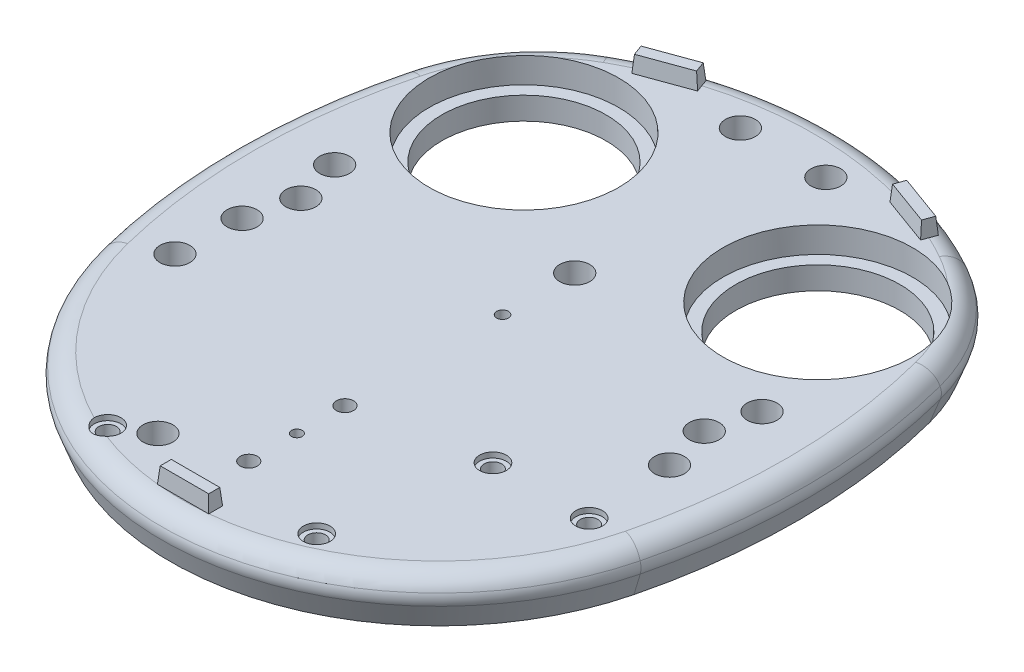
from build123d import *
from OCP.BRepFilletAPI import BRepFilletAPI_MakeChamfer

# Parameters (mm, degrees)
SKETCH1_R                     = 20
SKETCH1_R_2                   = 17.75
BOSS_EXTRUDE1_DEPTH           = 9
SKETCH2_R                     = 17.75
SKETCH2_R_2                   = 15.375
BOSS_EXTRUDE3_DEPTH           = 4.215
SKETCH4_R                     = 2.8
M3_TAPPING_INSERT_HOLES_DEPTH = 7
EXTRUDE_THIN2_START           = -9
EXTRUDE_THIN2_DEPTH           = 9
THUMB_KNUCKLE_HOLE_START      = -4.5875
SKETCH7_R                     = 15.25
THUMB_KNUCKLE_HOLE_DEPTH      = 106.441707798
SKETCH8_R                     = 1
SKETCH8_R_2                   = 1.6
THUMB_THROUGH_HOLE_S_DEPTH    = 111.029207798
SKETCH9_R                     = 1.1
CENTER_SCREW_THROUGH_DEPTH    = 111.029207798
CHAMFER1_SIZE                 = 5
CHAMFER1_SIZE2                = 1.869423397
FILLET1_R                     = 4
FILLET2_R                     = 3
CHAMFER_FITS_DEPTH            = 3
CHAMFER_FITS_DRAFT            = 5
SKETCH10_W                    = 9.6
SKETCH10_H                    = 2.6
CHAMFER_FITS_PROFILE_2_DEPTH  = 3
CHAMFER_FITS_PROFILE_2_DRAFT  = 5
CHAMFER_FITS_PROFILE_3_DEPTH  = 3
CHAMFER_FITS_PROFILE_3_DRAFT  = 5
SKETCH11_R                    = 1.65
M2_PRESS_INSERT_HOLES_DEPTH   = 5
SKETCH12_R                    = 2.5
M2_PRESS_INSERT_HEAD_DEPTH    = 1


with BuildPart() as part:
    # Sketch1 → Boss-Extrude1 (new body)
    # profile 1 of 3: a face of its own
    with BuildSketch(Plane(origin=(0, 0, 0), x_dir=(1, 0, 0), z_dir=(0, 1, 0))):
        with BuildLine():
            ThreePointArc((46.554987721, 6.075149623), (47.262334812, 3.074105201), (47.5, 0))
            ThreePointArc((47.5, 0), (9.667891023, -9.056262443), (39.298411056, 16.149225881))
            ThreePointArc((39.298411056, 16.149225881), (0, 28.975470321), (-39.298411056, 16.149225881))
            ThreePointArc((-39.298411056, 16.149225881), (-18.443737557, 17.832108977), (-7.5, 0))
            ThreePointArc((-7.5, 0), (-30.574105201, -19.762334812), (-46.554987721, 6.075149623))
            ThreePointArc((-46.554987721, 6.075149623), (-51.83640533, -24.60085732), (-48.549912051, -55.554205053))
            ThreePointArc((-48.549912051, -55.554205053), (0, -93.502323139), (48.549912051, -55.554205053))
            ThreePointArc((48.549912051, -55.554205053), (51.83640533, -24.60085732), (46.554987721, 6.075149623))
        make_face()
    # profile 2 of 3: a face of its own
    with BuildSketch(Plane(origin=(0, 0, 0), x_dir=(1, 0, 0), z_dir=(0, 1, 0))):
        with Locations((-27.5, 0)):
            Circle(SKETCH1_R)
        with Locations(Location((-27.5, 0, 0), (0, 0, 270))):
            Circle(SKETCH1_R_2, mode=Mode.SUBTRACT)
    # profile 3 of 3: a face of its own
    with BuildSketch(Plane(origin=(0, 0, 0), x_dir=(1, 0, 0), z_dir=(0, 1, 0))):
        with Locations((27.5, 0)):
            Circle(SKETCH1_R)
        with Locations(Location((27.5, 0, 0), (0, 0, 270))):
            Circle(SKETCH1_R_2, mode=Mode.SUBTRACT)
    extrude(amount=BOSS_EXTRUDE1_DEPTH)

    # Sketch2 → Boss-Extrude3 (add)
    # profile 1 of 2: a face of its own
    with BuildSketch(Plane(origin=(0, 0, 0), x_dir=(1, 0, 0), z_dir=(0, 1, 0))):
        with Locations(Location((-27.5, 0, 0), (0, 0, 270))):
            Circle(SKETCH2_R)
        with Locations(Location((-27.5, 0, 0), (0, 0, 270))):
            Circle(SKETCH2_R_2, mode=Mode.SUBTRACT)
    # profile 2 of 2: a face of its own
    with BuildSketch(Plane(origin=(0, 0, 0), x_dir=(1, 0, 0), z_dir=(0, 1, 0))):
        with Locations(Location((27.5, 0, 0), (0, 0, 270))):
            Circle(SKETCH2_R)
        with Locations(Location((27.5, 0, 0), (0, 0, 270))):
            Circle(SKETCH2_R_2, mode=Mode.SUBTRACT)
    extrude(amount=BOSS_EXTRUDE3_DEPTH)

    # Sketch4 → M3_Tapping_Insert_Holes (cut)
    with BuildSketch(Plane(origin=(0, 9, 0), x_dir=(1, 0, 0), z_dir=(0, 1, 0))):
        with Locations(Location((-8, 21.01, 0), (0, 0, 270))):
            Circle(SKETCH4_R)
        with Locations(Location((0, -18, 0), (0, 0, 270))):
            Circle(SKETCH4_R)
        with Locations(Location((-40, -22.9303, 0), (0, 0, 270))):
            Circle(SKETCH4_R)
        with Locations(Location((-37.75, -31.5038, 0), (0, 0, 270))):
            Circle(SKETCH4_R)
        with Locations(Location((-40, -40.255, 0), (0, 0, 270))):
            Circle(SKETCH4_R)
        with Locations(Location((-40.5, -52.3285, 0), (0, 0, 270))):
            Circle(SKETCH4_R)
        with Locations(Location((-13, -83, 0), (0, 0, 270))):
            Circle(SKETCH4_R)
        with Locations(Location((40, -40.255, 0), (0, 0, 90))):
            Circle(SKETCH4_R)
        with Locations(Location((37.75, -31.5038, 0), (0, 0, 90))):
            Circle(SKETCH4_R)
        with Locations(Location((40, -22.9303, 0), (0, 0, 90))):
            Circle(SKETCH4_R)
        with Locations(Location((8, 21.01, 0), (0, 0, 90))):
            Circle(SKETCH4_R)
    extrude(amount=-M3_TAPPING_INSERT_HOLES_DEPTH, mode=Mode.SUBTRACT)

    # Sketch5 → Extrude-Thin2 (add)
    with BuildSketch(Plane(origin=(0, 9, 0), x_dir=(1, 0, 0), z_dir=(0, 1, 0)).offset(EXTRUDE_THIN2_START)):
        with BuildLine():
            ThreePointArc((-50.490710842, -56.037216511), (-53.894544169, -27.770971196), (-50.251676697, 0.465463106))
            ThreePointArc((-50.251676697, 0.465463106), (-44.064896745, 13.114076138), (-33.394207534, 22.301026099))
            ThreePointArc((-33.394207534, 22.301026099), (0, 30.975470321), (33.394207534, 22.301026099))
            ThreePointArc((33.394207534, 22.301026099), (44.064896745, 13.114076138), (50.251676697, 0.465463106))
            ThreePointArc((50.251676697, 0.465463106), (53.894544169, -27.770971196), (50.490710842, -56.037216511))
            ThreePointArc((50.490710842, -56.037216511), (0, -95.502323157), (-50.490710842, -56.037216511))
        make_face()
        with BuildLine():
            ThreePointArc((-48.549912048, -55.554205085), (-51.894562065, -27.779432105), (-48.315034049, -0.033951806))
            ThreePointArc((-48.315034049, -0.033951806), (-42.481784381, 11.891883339), (-32.420848839, 20.55386473))
            ThreePointArc((-32.420848839, 20.55386473), (0, 28.975470321), (32.420848839, 20.55386473))
            ThreePointArc((32.420848839, 20.55386473), (42.481784381, 11.891883339), (48.315034049, -0.033951806))
            ThreePointArc((48.315034049, -0.033951806), (51.894562065, -27.779432105), (48.549912048, -55.554205085))
            ThreePointArc((48.549912048, -55.554205085), (0, -93.502323157), (-48.549912048, -55.554205085))
        make_face(mode=Mode.SUBTRACT)
    extrude(amount=EXTRUDE_THIN2_DEPTH)

    # Sketch7 → Thumb_Knuckle_Hole (cut, through all)
    with BuildSketch(Plane(origin=(0, 9, 0), x_dir=(1, 0, 0), z_dir=(0, 1, 0)).offset(THUMB_KNUCKLE_HOLE_START)):
        with Locations(Location((0, -70, 0), (0, 0, 270))):
            Circle(SKETCH7_R)
    extrude(amount=-THUMB_KNUCKLE_HOLE_DEPTH, mode=Mode.SUBTRACT)

    # Sketch8 → Thumb_Through_Hole(s) (cut, through all)
    with BuildSketch(Plane(origin=(0, 9, 0), x_dir=(1, 0, 0), z_dir=(0, 1, 0))):
        with Locations(Location((0, -70, 0), (0, 0, 270))):
            Circle(SKETCH8_R)
        with Locations(Location((0, -61, 0), (0, 0, 270))):
            Circle(SKETCH8_R_2)
        with Locations(Location((0, -79, 0), (0, 0, 270))):
            Circle(SKETCH8_R_2)
    extrude(amount=-THUMB_THROUGH_HOLE_S_DEPTH, mode=Mode.SUBTRACT)

    # Sketch9 → Center_Screw_Through (cut, through all)
    with BuildSketch(Plane(origin=(0, 9, 0), x_dir=(1, 0, 0), z_dir=(0, 1, 0))):
        with Locations(Location((0, -31.5037951, 0), (0, 0, 270))):
            Circle(SKETCH9_R)
    extrude(amount=-CENTER_SCREW_THROUGH_DEPTH, mode=Mode.SUBTRACT)

    # Chamfer1: one chamfer whose edges measure the first distance from different faces: ONE call of the kernel's chamfer builder (chamfer() names one face for all edges)
    chamfer1_edges_1 = [part.edges().sort_by_distance(p)[0] for p in [
        (53.894544169, 0, 27.770971196),
    ]]
    chamfer1_side_1 = [part.faces().sort_by_distance(p)[0] for p in [
        (53.894544169, 4.5, 27.770971196),
    ]]
    chamfer1_edges_2 = [part.edges().sort_by_distance(p)[0] for p in [
        (-44.064896745, 0, -13.114076138),
    ]]
    chamfer1_side_2 = [part.faces().sort_by_distance(p)[0] for p in [
        (-44.064896745, 4.5, -13.114076138),
    ]]
    chamfer1_edges_3 = [part.edges().sort_by_distance(p)[0] for p in [
        (0, 0, -30.975470321),
    ]]
    chamfer1_side_3 = [part.faces().sort_by_distance(p)[0] for p in [
        (0, 4.5, -30.975470321),
    ]]
    chamfer1_edges_4 = [part.edges().sort_by_distance(p)[0] for p in [
        (44.064896745, 0, -13.114076138),
    ]]
    chamfer1_side_4 = [part.faces().sort_by_distance(p)[0] for p in [
        (44.064896745, 4.5, -13.114076138),
    ]]
    chamfer1_edges_5 = [part.edges().sort_by_distance(p)[0] for p in [
        (0, 0, 95.502323157),
    ]]
    chamfer1_side_5 = [part.faces().sort_by_distance(p)[0] for p in [
        (0, 4.5, 95.502323157),
    ]]
    chamfer1_edges_6 = [part.edges().sort_by_distance(p)[0] for p in [
        (-53.894544169, 0, 27.770971196),
    ]]
    chamfer1_side_6 = [part.faces().sort_by_distance(p)[0] for p in [
        (-53.894544169, 4.5, 27.770971196),
    ]]
    chamfer1 = BRepFilletAPI_MakeChamfer(part.part.solid().wrapped)
    for e in chamfer1_edges_1:
        chamfer1.Add(CHAMFER1_SIZE, CHAMFER1_SIZE2, e.wrapped, chamfer1_side_1[0].wrapped)  # the first distance lies on this face
    for e in chamfer1_edges_2:
        chamfer1.Add(CHAMFER1_SIZE, CHAMFER1_SIZE2, e.wrapped, chamfer1_side_2[0].wrapped)  # the first distance lies on this face
    for e in chamfer1_edges_3:
        chamfer1.Add(CHAMFER1_SIZE, CHAMFER1_SIZE2, e.wrapped, chamfer1_side_3[0].wrapped)  # the first distance lies on this face
    for e in chamfer1_edges_4:
        chamfer1.Add(CHAMFER1_SIZE, CHAMFER1_SIZE2, e.wrapped, chamfer1_side_4[0].wrapped)  # the first distance lies on this face
    for e in chamfer1_edges_5:
        chamfer1.Add(CHAMFER1_SIZE, CHAMFER1_SIZE2, e.wrapped, chamfer1_side_5[0].wrapped)  # the first distance lies on this face
    for e in chamfer1_edges_6:
        chamfer1.Add(CHAMFER1_SIZE, CHAMFER1_SIZE2, e.wrapped, chamfer1_side_6[0].wrapped)  # the first distance lies on this face
    add(Compound.cast(chamfer1.Shape()), mode=Mode.REPLACE)

    # Fillet1
    # the kernel refuses this fillet: 4 mm, written as the material it takes off along each edge
    with BuildSketch(Plane(origin=(-16.36043036, 9, 8.27429786), x_dir=(-0.96832132390781, 0, -0.2497074561670639), z_dir=(-0.2497074561670639, 0, 0.96832132390781))) as fillet1_piece_1:
        with BuildLine():
            CenterArc((35 - FILLET1_R, FILLET1_R), FILLET1_R, 270, 90)
            Line((35 - FILLET1_R, 0), (35, 0))
            Line((35, 0), (35, FILLET1_R))
        make_face()
    revolve(axis=Axis((-16.36043036, 9, 8.27429786), (0, -1, 0)), revolution_arc=46.417240957, mode=Mode.SUBTRACT)
    with BuildSketch(Plane(origin=(0, 9, 37.640976386), x_dir=(-0.48667934783574135, 0, -0.8735806845335911), z_dir=(-0.8735806845335911, 0, 0.48667934783574135))) as fillet1_piece_2:
        with BuildLine():
            CenterArc((68.616446707 - FILLET1_R, FILLET1_R), FILLET1_R, 270, 90)
            Line((68.616446707 - FILLET1_R, 0), (68.616446707, 0))
            Line((68.616446707, 0), (68.616446707, FILLET1_R))
        make_face()
    revolve(axis=Axis((0, 9, 37.640976386), (0, -1, 0)), revolution_arc=58.245114826, mode=Mode.SUBTRACT)
    with BuildSketch(Plane(origin=(16.36043036, 9, 8.27429786), x_dir=(0.4866793478357412, 0, -0.8735806845335913), z_dir=(-0.8735806845335913, 0, -0.4866793478357412))) as fillet1_piece_3:
        with BuildLine():
            CenterArc((35 - FILLET1_R, FILLET1_R), FILLET1_R, 270, 90)
            Line((35 - FILLET1_R, 0), (35, 0))
            Line((35, 0), (35, FILLET1_R))
        make_face()
    revolve(axis=Axis((16.36043036, 9, 8.27429786), (0, -1, 0)), revolution_arc=46.417240957, mode=Mode.SUBTRACT)
    with BuildSketch(Plane(origin=(-61.131227784, 9, 28.257586828), x_dir=(0.968321323907809, 0, -0.24970745616706774), z_dir=(-0.24970745616706774, 0, -0.968321323907809))) as fillet1_piece_4:
        with BuildLine():
            CenterArc((115.02680126 - FILLET1_R, FILLET1_R), FILLET1_R, 270, 90)
            Line((115.02680126 - FILLET1_R, 0), (115.02680126, 0))
            Line((115.02680126, 0), (115.02680126, FILLET1_R))
        make_face()
    revolve(axis=Axis((-61.131227784, 9, 28.257586828), (0, -1, 0)), revolution_arc=28.435627455, mode=Mode.SUBTRACT)
    with BuildSketch(Plane(origin=(0, 9, 43.471467637), x_dir=(0.970399397391295, 0, 0.24150571327115955), z_dir=(0.24150571327115955, 0, -0.970399397391295))) as fillet1_piece_5:
        with BuildLine():
            CenterArc((52.03085552 - FILLET1_R, FILLET1_R), FILLET1_R, 270, 90)
            Line((52.03085552 - FILLET1_R, 0), (52.03085552, 0))
            Line((52.03085552, 0), (52.03085552, FILLET1_R))
        make_face()
    revolve(axis=Axis((0, 9, 43.471467637), (0, -1, 0)), revolution_arc=152.04914835, mode=Mode.SUBTRACT)
    with BuildSketch(Plane(origin=(61.131227784, 9, 28.257586828), x_dir=(-0.9703993973912952, 0, 0.2415057132711584), z_dir=(0.2415057132711584, 0, 0.9703993973912952))) as fillet1_piece_6:
        with BuildLine():
            CenterArc((115.02680126 - FILLET1_R, FILLET1_R), FILLET1_R, 270, 90)
            Line((115.02680126 - FILLET1_R, 0), (115.02680126, 0))
            Line((115.02680126, 0), (115.02680126, FILLET1_R))
        make_face()
    revolve(axis=Axis((61.131227784, 9, 28.257586828), (0, -1, 0)), revolution_arc=28.435627455, mode=Mode.SUBTRACT)

    # Fillet2
    fillet2_edges = [part.edges().sort_by_distance(p)[0] for p in [
        (-44.064896745, 5, -13.114076138),
        (0, 5, -30.975470321),
        (-53.894544169, 5, 27.770971196),
        (44.064896745, 5, -13.114076138),
        (0, 5, 95.502323157),
        (53.894544169, 5, 27.770971196),
    ]]
    fillet(fillet2_edges, radius=FILLET2_R)


with BuildPart() as chamfer_fits_tool:
    # Sketch10 → Chamfer_Fits (with draft: the straight prism first)
    with BuildSketch(Plane(origin=(0, 9, 0), x_dir=(1, 0, 0), z_dir=(0, 1, 0))):
        Polygon((-18.889252373, 25.443200814), (-27.910301532, 22.159807438), (-27.02104916, 19.716606624), (-18, 23), align=None)
    extrude(amount=CHAMFER_FITS_DEPTH)
    # Chamfer_Fits: the draft: its side faces are tilted about the plane it starts from
    chamfer_fits_sides = [chamfer_fits_tool.faces().sort_by_distance(p)[0] for p in [
        (-23.399776952, 10.5, -23.801504126),
        (-27.465675346, 10.5, -20.938207031),
        (-22.51052458, 10.5, -21.358303312),
        (-18.444626186, 10.5, -24.221600407),
    ]]
    draft(chamfer_fits_sides, Plane(origin=(0, 9, 0), x_dir=(1, 0, 0), z_dir=(0, 1, 0)), CHAMFER_FITS_DRAFT)


with BuildPart() as part_1:
    add(part.part)

    # Chamfer_Fits: add chamfer_fits_tool
    add(chamfer_fits_tool.part)


with BuildPart() as chamfer_fits_profile_2_tool:
    # Sketch10 → Chamfer_Fits profile 2 (with draft: the straight prism first)
    with BuildSketch(Plane(origin=(0, 9, 0), x_dir=(1, 0, 0), z_dir=(0, 1, 0))):
        with Locations((0, -90)):
            Rectangle(SKETCH10_W, SKETCH10_H)
    extrude(amount=CHAMFER_FITS_PROFILE_2_DEPTH)
    # Chamfer_Fits profile 2: the draft: its side faces are tilted about the plane it starts from
    chamfer_fits_profile_2_sides = [chamfer_fits_profile_2_tool.faces().sort_by_distance(p)[0] for p in [
        (0, 10.5, 91.3),
        (4.8, 10.5, 90),
        (0, 10.5, 88.7),
        (-4.8, 10.5, 90),
    ]]
    draft(chamfer_fits_profile_2_sides, Plane(origin=(0, 9, 0), x_dir=(1, 0, 0), z_dir=(0, 1, 0)), CHAMFER_FITS_PROFILE_2_DRAFT)


with BuildPart() as part_2:
    add(part_1.part)

    # Chamfer_Fits profile 2: add chamfer_fits_profile_2_tool
    add(chamfer_fits_profile_2_tool.part)


with BuildPart() as chamfer_fits_profile_3_tool:
    # Sketch10 → Chamfer_Fits profile 3 (with draft: the straight prism first)
    with BuildSketch(Plane(origin=(0, 9, 0), x_dir=(1, 0, 0), z_dir=(0, 1, 0))):
        Polygon((18.889252373, 25.443200814), (18, 23), (27.02104916, 19.716606624), (27.910301532, 22.159807438), align=None)
    extrude(amount=CHAMFER_FITS_PROFILE_3_DEPTH)
    # Chamfer_Fits profile 3: the draft: its side faces are tilted about the plane it starts from
    chamfer_fits_profile_3_sides = [chamfer_fits_profile_3_tool.faces().sort_by_distance(p)[0] for p in [
        (18.444626186, 10.5, -24.221600407),
        (22.51052458, 10.5, -21.358303312),
        (27.465675346, 10.5, -20.938207031),
        (23.399776952, 10.5, -23.801504126),
    ]]
    draft(chamfer_fits_profile_3_sides, Plane(origin=(0, 9, 0), x_dir=(1, 0, 0), z_dir=(0, 1, 0)), CHAMFER_FITS_PROFILE_3_DRAFT)


with BuildPart() as part_3:
    add(part_2.part)

    # Chamfer_Fits profile 3: add chamfer_fits_profile_3_tool
    add(chamfer_fits_profile_3_tool.part)

    # Sketch11 → M2_Press_Insert_Holes (cut)
    with BuildSketch(Plane(origin=(0, 9, 0), x_dir=(1, 0, 0), z_dir=(0, 1, 0))):
        with Locations(Location((23.1124, -56.412, 0), (0, 0, 270))):
            Circle(SKETCH11_R)
        with Locations(Location((41.1124, -56.412, 0), (0, 0, 270))):
            Circle(SKETCH11_R)
        with Locations(Location((18.1124, -84.412, 0), (0, 0, 270))):
            Circle(SKETCH11_R)
        with Locations(Location((-19.0056, -86.412, 0), (0, 0, 270))):
            Circle(SKETCH11_R)
    extrude(amount=-M2_PRESS_INSERT_HOLES_DEPTH, mode=Mode.SUBTRACT)

    # Sketch12 → M2_Press_Insert_Head (cut)
    with BuildSketch(Plane(origin=(0, 9, 0), x_dir=(1, 0, 0), z_dir=(0, 1, 0))):
        with Locations(Location((23.1124, -56.412, 0), (0, 0, 270))):
            Circle(SKETCH12_R)
        with Locations(Location((41.1124, -56.412, 0), (0, 0, 270))):
            Circle(SKETCH12_R)
        with Locations(Location((18.1124, -84.412, 0), (0, 0, 270))):
            Circle(SKETCH12_R)
        with Locations(Location((-19.0056, -86.412, 0), (0, 0, 270))):
            Circle(SKETCH12_R)
    extrude(amount=-M2_PRESS_INSERT_HEAD_DEPTH, mode=Mode.SUBTRACT)


solid = part_3.part
